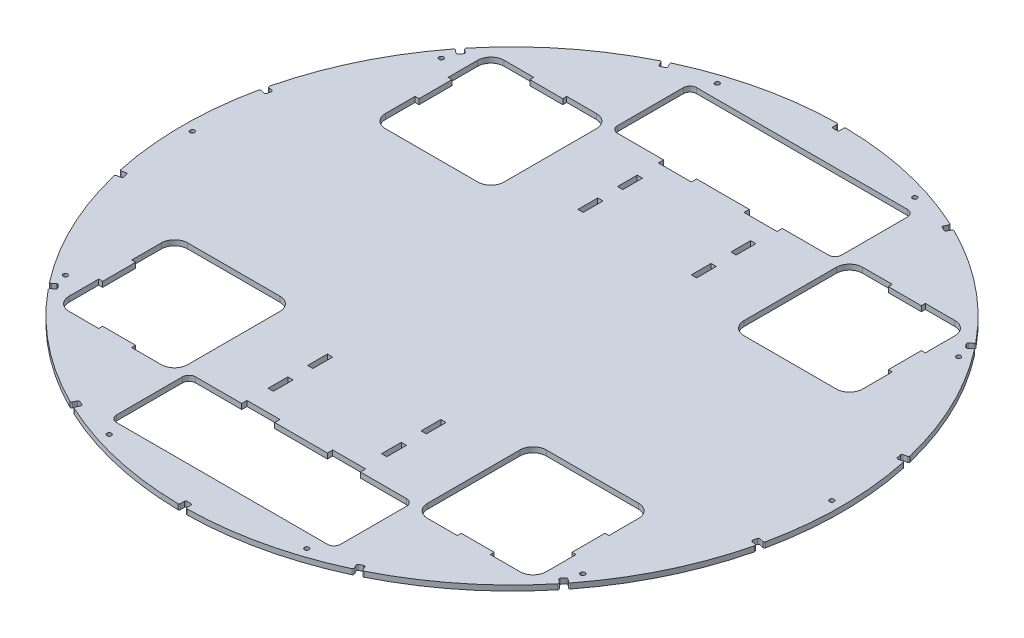
from build123d import *

# Parameters (mm, degrees)
SKETCH1_R                = 250
BOSS_EXTRUDE1_DEPTH      = 4
CUT_EXTRUDE1_DEPTH       = 10
SKETCH3_W                = 25
SKETCH3_H                = 4
CUT_EXTRUDE2_DEPTH       = 5
SKETCH4_W                = 4
SKETCH4_H                = 15
CUT_EXTRUDE3_DEPTH       = 20
CUT_EXTRUDE4_DEPTH       = 5
SKETCH8_W                = 6
SKETCH8_H                = 25
SKETCH8_W_2              = 25
SKETCH8_H_2              = 6
BOSS_EXTRUDE2_DEPTH      = 4
CUT_EXTRUDE5_DEPTH       = 4
FILLET1_R                = 1
CIRPATTERN1_COUNT        = 14
FILLET1_OF_CIRPATTERN1_R = 1
SKETCH12_R               = 1.7
CUT_EXTRUDE6_DEPTH       = 10
CIRPATTERN2_COUNT        = 10


with BuildPart() as part:
    # Sketch1 → Boss-Extrude1 (new body)
    with BuildSketch(Plane(origin=(0, 0, 0), x_dir=(1, 0, 0), z_dir=(0, 1, 0))):
        Circle(SKETCH1_R)
    extrude(amount=BOSS_EXTRUDE1_DEPTH)

    # Sketch2 → Cut-Extrude1 (cut)
    with BuildSketch(Plane(origin=(0, 4, 0), x_dir=(1, 0, 0), z_dir=(0, 1, 0))):
        with BuildLine():
            Line((80, 220), (-80, 220))
            ThreePointArc((-80, 220), (-83.535533906, 218.535533906), (-85, 215))
            Line((-85, 215), (-85, 165))
            ThreePointArc((-85, 165), (-83.535533906, 161.464466094), (-80, 160))
            Line((-80, 160), (80, 160))
            ThreePointArc((80, 160), (83.535533906, 161.464466094), (85, 165))
            Line((85, 165), (85, 215))
            ThreePointArc((85, 215), (83.535533906, 218.535533906), (80, 220))
        make_face()
        with BuildLine():
            Line((85, -215), (85, -165))
            ThreePointArc((85, -165), (83.535533906, -161.464466094), (80, -160))
            Line((80, -160), (-80, -160))
            ThreePointArc((-80, -160), (-83.535533906, -161.464466094), (-85, -165))
            Line((-85, -165), (-85, -215))
            ThreePointArc((-85, -215), (-83.535533906, -218.535533906), (-80, -220))
            Line((-80, -220), (80, -220))
            ThreePointArc((80, -220), (83.535533906, -218.535533906), (85, -215))
        make_face()
    extrude(amount=-CUT_EXTRUDE1_DEPTH, mode=Mode.SUBTRACT)

    # Sketch3 → Cut-Extrude2 (cut)
    with BuildSketch(Plane(origin=(0, 4, 0), x_dir=(1, 0, 0), z_dir=(0, 1, 0))):
        with Locations((32.5, 158)):
            Rectangle(SKETCH3_W, SKETCH3_H)
        with Locations((-32.5, 158)):
            Rectangle(SKETCH3_W, SKETCH3_H)
        with Locations((-32.5, -158)):
            Rectangle(SKETCH3_W, SKETCH3_H)
        with Locations((32.5, -158)):
            Rectangle(SKETCH3_W, SKETCH3_H)
    extrude(amount=-CUT_EXTRUDE2_DEPTH, mode=Mode.SUBTRACT)

    # Sketch4 → Cut-Extrude3 (cut)
    with BuildSketch(Plane(origin=(0, 4, 0), x_dir=(1, 0, 0), z_dir=(0, 1, 0))):
        with Locations((43, 132.5)):
            Rectangle(SKETCH4_W, SKETCH4_H)
        with Locations((43, 102.5)):
            Rectangle(SKETCH4_W, SKETCH4_H)
        with Locations((-43, 102.5)):
            Rectangle(SKETCH4_W, SKETCH4_H)
        with Locations((-43, 132.5)):
            Rectangle(SKETCH4_W, SKETCH4_H)
        with Locations((-43, -132.5)):
            Rectangle(SKETCH4_W, SKETCH4_H)
        with Locations((-43, -102.5)):
            Rectangle(SKETCH4_W, SKETCH4_H)
        with Locations((43, -102.5)):
            Rectangle(SKETCH4_W, SKETCH4_H)
        with Locations((43, -132.5)):
            Rectangle(SKETCH4_W, SKETCH4_H)
    extrude(amount=-CUT_EXTRUDE3_DEPTH, mode=Mode.SUBTRACT)

    # Sketch7 → Cut-Extrude4 (cut)
    with BuildSketch(Plane(origin=(0, 4, 0), x_dir=(1, 0, 0), z_dir=(0, 1, 0))):
        with BuildLine():
            Line((-101, 75), (-171, 75))
            ThreePointArc((-171, 75), (-178.071067812, 77.928932188), (-181, 85))
            Line((-181, 85), (-181, 155))
            ThreePointArc((-181, 155), (-178.071067812, 162.071067812), (-171, 165))
            Line((-171, 165), (-101, 165))
            ThreePointArc((-101, 165), (-93.928932188, 162.071067812), (-91, 155))
            Line((-91, 155), (-91, 85))
            ThreePointArc((-91, 85), (-93.928932188, 77.928932188), (-101, 75))
        make_face()
        with BuildLine():
            Line((181, 85), (181, 155))
            ThreePointArc((181, 155), (178.071067812, 162.071067812), (171, 165))
            Line((171, 165), (101, 165))
            ThreePointArc((101, 165), (93.928932188, 162.071067812), (91, 155))
            Line((91, 155), (91, 85))
            ThreePointArc((91, 85), (93.928932188, 77.928932188), (101, 75))
            Line((101, 75), (171, 75))
            ThreePointArc((171, 75), (178.071067812, 77.928932188), (181, 85))
        make_face()
        with BuildLine():
            Line((101, -75), (171, -75))
            ThreePointArc((171, -75), (178.071067812, -77.928932188), (181, -85))
            Line((181, -85), (181, -155))
            ThreePointArc((181, -155), (178.071067812, -162.071067812), (171, -165))
            Line((171, -165), (101, -165))
            ThreePointArc((101, -165), (93.928932188, -162.071067812), (91, -155))
            Line((91, -155), (91, -85))
            ThreePointArc((91, -85), (93.928932188, -77.928932188), (101, -75))
        make_face()
        with BuildLine():
            Line((-181, -85), (-181, -155))
            ThreePointArc((-181, -155), (-178.071067812, -162.071067812), (-171, -165))
            Line((-171, -165), (-101, -165))
            ThreePointArc((-101, -165), (-93.928932188, -162.071067812), (-91, -155))
            Line((-91, -155), (-91, -85))
            ThreePointArc((-91, -85), (-93.928932188, -77.928932188), (-101, -75))
            Line((-101, -75), (-171, -75))
            ThreePointArc((-171, -75), (-178.071067812, -77.928932188), (-181, -85))
        make_face()
    extrude(amount=-CUT_EXTRUDE4_DEPTH, mode=Mode.SUBTRACT)

    # Sketch8 → Boss-Extrude2 (add)
    with BuildSketch(Plane(origin=(0, 4, 0), x_dir=(1, 0, 0), z_dir=(0, 1, 0))):
        with Locations((-181, 120)):
            Rectangle(SKETCH8_W, SKETCH8_H)
        with Locations((-136, 165)):
            Rectangle(SKETCH8_W_2, SKETCH8_H_2)
        with Locations((136, 165)):
            Rectangle(SKETCH8_W_2, SKETCH8_H_2)
        with Locations((181, 120)):
            Rectangle(SKETCH8_W, SKETCH8_H)
        with Locations((181, -120)):
            Rectangle(SKETCH8_W, SKETCH8_H)
        with Locations((136, -165)):
            Rectangle(SKETCH8_W_2, SKETCH8_H_2)
        with Locations((-136, -165)):
            Rectangle(SKETCH8_W_2, SKETCH8_H_2)
        with Locations((-181, -120)):
            Rectangle(SKETCH8_W, SKETCH8_H)
    extrude(amount=-BOSS_EXTRUDE2_DEPTH)

    # Sketch11 → Cut-Extrude5 (cut)
    with BuildSketch(Plane(origin=(0, 4, 0), x_dir=(1, 0, 0), z_dir=(0, 1, 0))):
        with BuildLine():
            Line((1.5, 245), (-1.5, 245))
            ThreePointArc((-1.5, 245), (-2.207106781, 245.292893219), (-2.5, 246))
            Line((-2.5, 246), (-2.5, 255))
            Line((-2.5, 255), (2.5, 255))
            Line((2.5, 255), (2.5, 246))
            ThreePointArc((2.5, 246), (2.207106781, 245.292893219), (1.5, 245))
        make_face()
    cut_extrude5 = extrude(amount=-CUT_EXTRUDE5_DEPTH, mode=Mode.SUBTRACT)

    # Fillet1
    fillet1_edges = [part.edges().sort_by_distance(p)[0] for p in [
        (2.5, 2, -249.987499687),
        (-2.5, 2, -249.987499687),
    ]]
    fillet(fillet1_edges, radius=FILLET1_R)

    # CirPattern1: Cut-Extrude5 ×14 about axis
    cirpattern1_axis = Axis((0, 4, 0), (0, -1, 0))
    for i in range(1, CIRPATTERN1_COUNT):
        add(cut_extrude5.rotate(cirpattern1_axis, i * 360 / CIRPATTERN1_COUNT), mode=Mode.SUBTRACT)

    # Fillet1 of CirPattern1
    fillet1_of_cirpattern1_edges = [part.edges().sort_by_distance(p)[0] for p in [
        (110.717933267, 2, -224.146245235),
        (106.213088927, 2, -226.315663931),
        (197.006821984, 2, -153.910077941),
        (193.889372974, 2, -157.819235353),
        (244.276093477, 2, -53.190132127),
        (243.163488807, 2, -58.064771688),
        (243.163488807, 2, 58.064771688),
        (244.276093477, 2, 53.190132127),
        (193.889372974, 2, 157.819235353),
        (197.006821984, 2, 153.910077941),
        (106.213088927, 2, 226.315663931),
        (110.717933267, 2, 224.146245235),
        (-2.5, 2, 249.987499687),
        (2.5, 2, 249.987499687),
        (-110.717933267, 2, 224.146245235),
        (-106.213088927, 2, 226.315663931),
        (-197.006821984, 2, 153.910077941),
        (-193.889372974, 2, 157.819235353),
        (-244.276093477, 2, 53.190132127),
        (-243.163488807, 2, 58.064771688),
        (-243.163488807, 2, -58.064771688),
        (-244.276093477, 2, -53.190132127),
        (-193.889372974, 2, -157.819235353),
        (-197.006821984, 2, -153.910077941),
        (-106.213088927, 2, -226.315663931),
        (-110.717933267, 2, -224.146245235),
    ]]
    fillet(fillet1_of_cirpattern1_edges, radius=FILLET1_OF_CIRPATTERN1_R)

    # Sketch12 → Cut-Extrude6 (cut)
    with BuildSketch(Plane(origin=(0, 4, 0), x_dir=(1, 0, 0), z_dir=(0, 1, 0))):
        with Locations((-242.5, 0)):
            Circle(SKETCH12_R)
    cut_extrude6 = extrude(amount=-CUT_EXTRUDE6_DEPTH, mode=Mode.SUBTRACT)

    # CirPattern2: Cut-Extrude6 ×10 about axis
    cirpattern2_axis = Axis((0, 4, 0), (0, -1, 0))
    for i in range(1, CIRPATTERN2_COUNT):
        add(cut_extrude6.rotate(cirpattern2_axis, i * 360 / CIRPATTERN2_COUNT), mode=Mode.SUBTRACT)


solid = part.part
